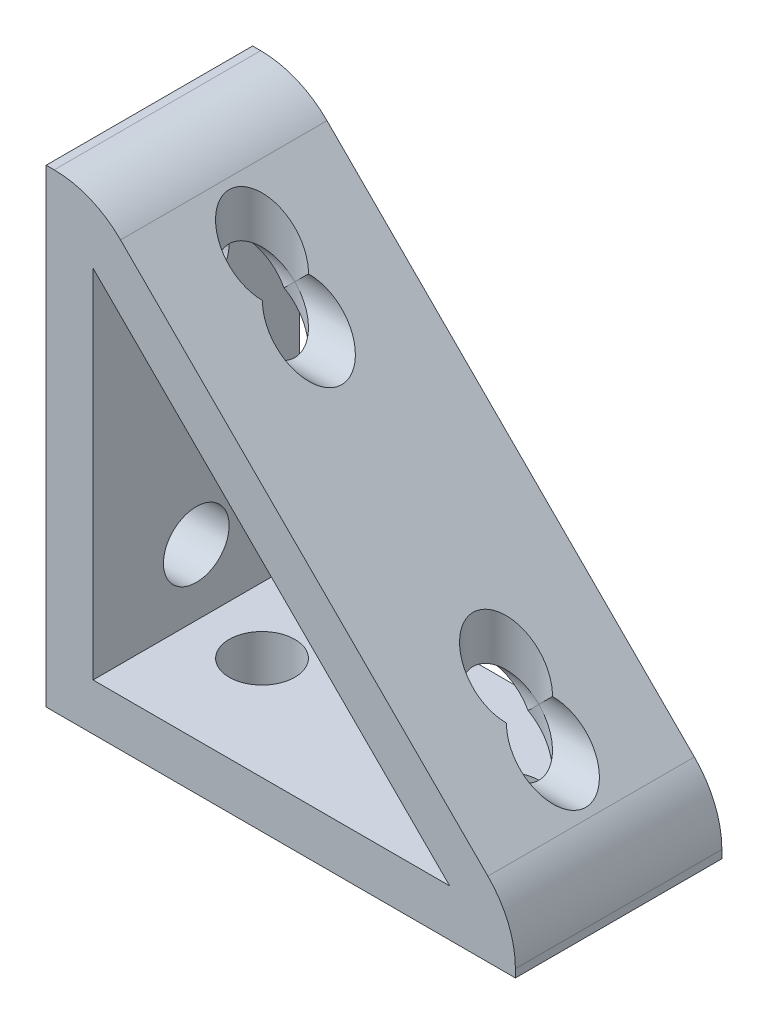
from build123d import *

# Parameters (mm, degrees)
BOSS_EXTRUDE1_DEPTH = 11
FILLET1_R           = 10
FILLET2_R           = 10
SKETCH2_R           = 3.5
CUT_EXTRUDE2_DEPTH  = 72.561162651
CUT_EXTRUDE3_DEPTH  = 46.5


# Read off the part's stored shape, not the designer's step: Cut-Extrude3
with BuildPart() as part:
    # Sketch1 → Boss-Extrude1 (new, symmetric)
    with BuildSketch(Plane.XY):
        Polygon((0, 50), (0, 0), (50, 0), (50, 5), (5, 50), align=None)
        Polygon((43, 5), (5, 5), (5, 43), align=None, mode=Mode.SUBTRACT)
    extrude(amount=BOSS_EXTRUDE1_DEPTH, both=True)

    # Fillet1
    fillet1_edges = [part.edges().sort_by_distance(p)[0] for p in [
        (5, 50, 0),
    ]]
    fillet(fillet1_edges, radius=FILLET1_R)

    # Fillet2
    fillet2_edges = [part.edges().sort_by_distance(p)[0] for p in [
        (50, 5, 0),
    ]]
    fillet(fillet2_edges, radius=FILLET2_R)

    # Sketch2 → Cut-Extrude2 (cut, through all)
    with BuildSketch(Plane.ZY):
        with Locations(Location((0, 38, 0), (0, 0, 270))):
            Circle(SKETCH2_R)
        with Locations(Location((0, 12, 0), (0, 0, 270))):
            Circle(SKETCH2_R)
    extrude(amount=-CUT_EXTRUDE2_DEPTH, mode=Mode.SUBTRACT)

    # Cut-Extrude3 outline → Cut-Extrude3 (cut)
    with BuildSketch(Plane(origin=(0, 0, 0), x_dir=(1, 0, 0), z_dir=(0, 1, 0))):
        with BuildLine():
            ThreePointArc((11, -3.354101966), (15.5, 0), (11, 3.354101966))
            ThreePointArc((11, 3.354101966), (8.5, 0), (11, -3.354101966))
        make_face()
        with BuildLine():
            ThreePointArc((37, -3.354101966), (41.5, 0), (37, 3.354101966))
            ThreePointArc((37, 3.354101966), (34.5, 0), (37, -3.354101966))
        make_face()
    extrude(amount=CUT_EXTRUDE3_DEPTH, mode=Mode.SUBTRACT)


solid = part.part
